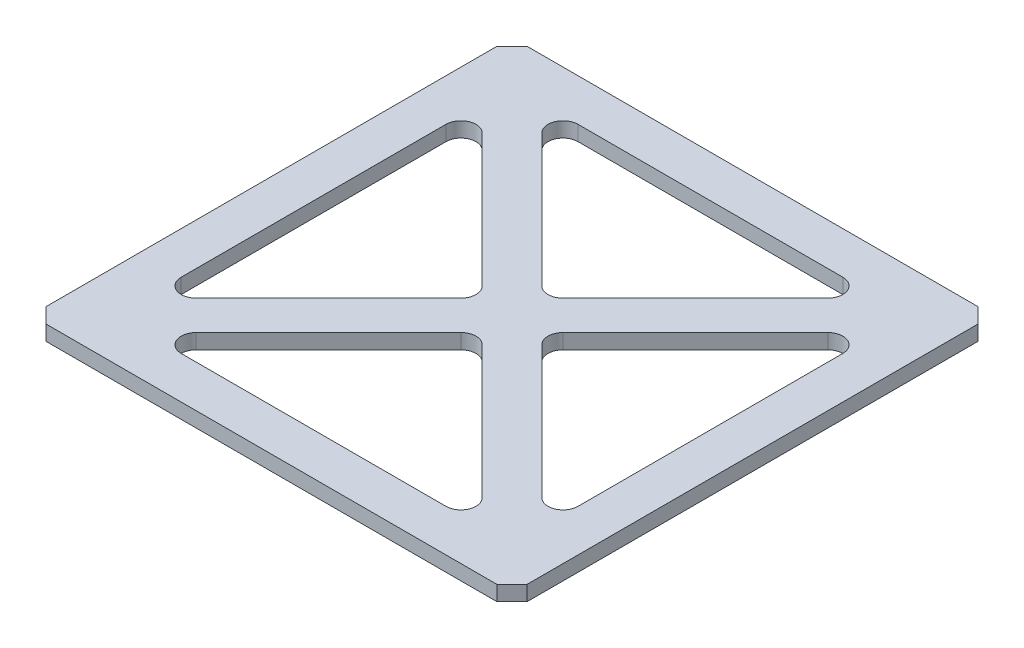
from build123d import *

# Parameters (mm, degrees)
BOSS_EXTRUDE1_DEPTH = 6.35
CUT_EXTRUDE1_DEPTH  = 288.438345563


with BuildPart() as part:
    # Sketch1 → Boss-Extrude1 (new body)
    with BuildSketch(Plane(origin=(0, 0, 0), x_dir=(1, 0, 0), z_dir=(0, 1, 0))):
        Polygon((0, 196.85), (6.35, 203.2), (196.85, 203.2), (203.2, 196.85), (203.2, 6.35), (196.85, 0), (6.35, 0), (0, 6.35), align=None)
    extrude(amount=BOSS_EXTRUDE1_DEPTH)

    # Sketch2 → Cut-Extrude1 (cut, through all)
    with BuildSketch(Plane(origin=(0, 6.35, 0), x_dir=(1, 0, 0), z_dir=(0, 1, 0))):
        with BuildLine():
            Line((45.682614691, 185.42), (157.517385309, 185.42))
            ThreePointArc((157.517385309, 185.42), (163.384020341, 181.500039796), (162.00751337, 174.579871939))
            Line((162.00751337, 174.579871939), (106.090128061, 118.66248663))
            ThreePointArc((106.090128061, 118.66248663), (101.6, 116.802614691), (97.109871939, 118.66248663))
            Line((97.109871939, 118.66248663), (41.19248663, 174.579871939))
            ThreePointArc((41.19248663, 174.579871939), (39.815979659, 181.500039796), (45.682614691, 185.42))
        make_face()
        with BuildLine():
            Line((17.78, 157.517385309), (17.78, 45.682614691))
            ThreePointArc((17.78, 45.682614691), (21.699960204, 39.815979659), (28.620128061, 41.19248663))
            Line((28.620128061, 41.19248663), (84.53751337, 97.109871939))
            ThreePointArc((84.53751337, 97.109871939), (86.397385309, 101.6), (84.53751337, 106.090128061))
            Line((84.53751337, 106.090128061), (28.620128061, 162.00751337))
            ThreePointArc((28.620128061, 162.00751337), (21.699960204, 163.384020341), (17.78, 157.517385309))
        make_face()
        with BuildLine():
            Line((45.682614691, 17.78), (157.517385309, 17.78))
            ThreePointArc((157.517385309, 17.78), (163.384020341, 21.699960204), (162.00751337, 28.620128061))
            Line((162.00751337, 28.620128061), (106.090128061, 84.53751337))
            ThreePointArc((106.090128061, 84.53751337), (101.6, 86.397385309), (97.109871939, 84.53751337))
            Line((97.109871939, 84.53751337), (41.19248663, 28.620128061))
            ThreePointArc((41.19248663, 28.620128061), (39.815979659, 21.699960204), (45.682614691, 17.78))
        make_face()
        with BuildLine():
            Line((185.42, 157.517385309), (185.42, 45.682614691))
            ThreePointArc((185.42, 45.682614691), (181.500039796, 39.815979659), (174.579871939, 41.19248663))
            Line((174.579871939, 41.19248663), (118.66248663, 97.109871939))
            ThreePointArc((118.66248663, 97.109871939), (116.802614691, 101.6), (118.66248663, 106.090128061))
            Line((118.66248663, 106.090128061), (174.579871939, 162.00751337))
            ThreePointArc((174.579871939, 162.00751337), (181.500039796, 163.384020341), (185.42, 157.517385309))
        make_face()
    extrude(amount=-CUT_EXTRUDE1_DEPTH, mode=Mode.SUBTRACT)


solid = part.part
